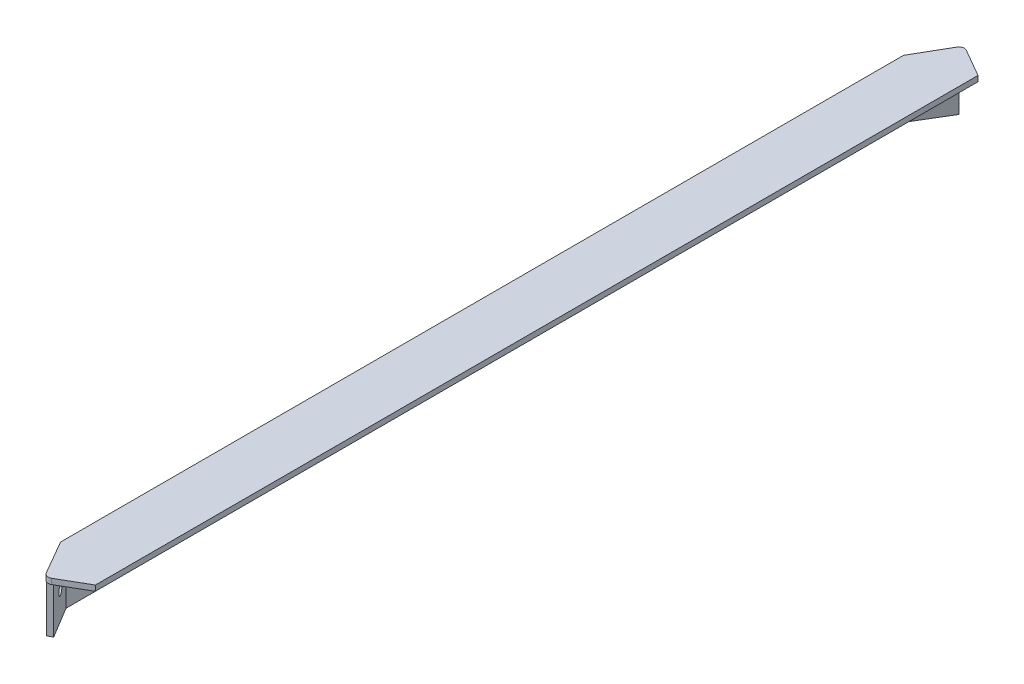
from build123d import *

# Parameters (mm, degrees)
BOSS_EXTRUDE1_DEPTH = 540
BOSS_EXTRUDE2_DEPTH = 63
BOSS_EXTRUDE4_DEPTH = 7
SKETCH10_R          = 6
CUT_EXTRUDE3_DEPTH  = 7
FILLET5_R           = 5


with BuildPart() as part:
    # Sketch1 → Boss-Extrude1 (new body)
    with BuildSketch(Plane.XY):
        Polygon((0, 0), (0, 70), (70, 70), (70, 63), (7, 63), (7, 0), align=None)
    extrude(amount=BOSS_EXTRUDE1_DEPTH)

    # Sketch2 → Boss-Extrude2 (add)
    with BuildSketch(Plane(origin=(0, 0, 0), x_dir=(1, 0, 0), z_dir=(0, 1, 0))):
        Polygon((0, -540), (25, -583.301270189), (31.062177826, -579.801270189), (7, -540), align=None)
    extrude(amount=BOSS_EXTRUDE2_DEPTH)

    # Sketch9 → Boss-Extrude4 (add)
    with BuildSketch(Plane(origin=(0, 63, 0), x_dir=(1, 0, 0), z_dir=(0, 1, 0))):
        with BuildLine():
            Line((0, -540), (25, -583.301270189))
            ThreePointArc((25, -583.301270189), (29.250444511, -586.562750973), (34.562177826, -585.863448016))
            Line((34.562177826, -585.863448016), (70, -565.403411844))
            Line((70, -565.403411844), (70, -540))
            Line((70, -540), (0, -540))
        make_face()
    extrude(amount=BOSS_EXTRUDE4_DEPTH)

    # Sketch10 → Cut-Extrude3 (cut)
    with BuildSketch(Plane(origin=(-233.953556616, 0, 141.438503236), x_dir=(-0.5173609804017633, 0, -0.8557672674026079), z_dir=(0.8557672674026079, 0, -0.5173609804017633))):
        with Locations((-487.2453074, 35)):
            Circle(SKETCH10_R)
    extrude(amount=-CUT_EXTRUDE3_DEPTH, mode=Mode.SUBTRACT)

    # Fillet5
    fillet5_edges = [part.edges().sort_by_distance(p)[0] for p in [
        (19.031088913, 63, 559.900635095),
        (7, 63, 270),
    ]]
    fillet(fillet5_edges, radius=FILLET5_R)

    # Mirror6: part across plane


with BuildPart() as part_1:
    add(part.part)
    add(part.part.mirror(Plane.XY))


solid = part_1.part
